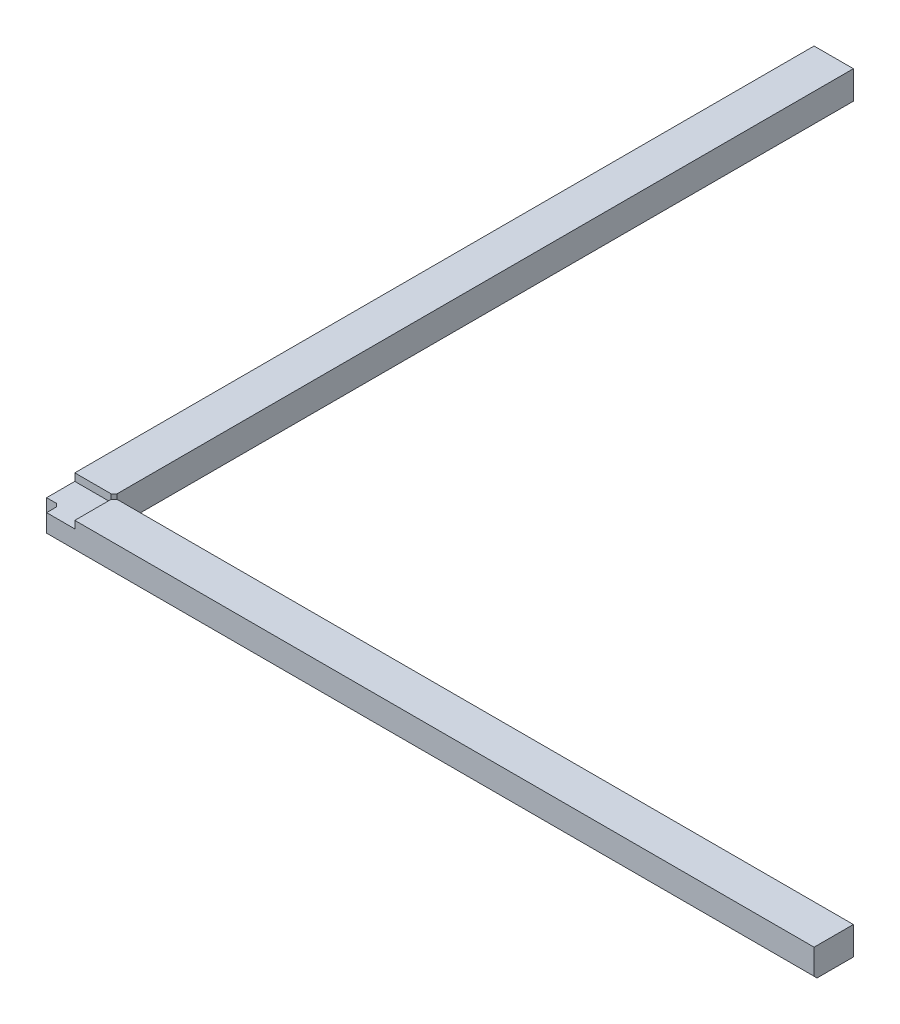
from build123d import *

# Parameters (mm, degrees)
BOSS_EXTRU_1_DEPTH      = 3.8
ENL_V_MAT_EXTRU_1_DEPTH = 1
ENL_V_MAT_EXTRU_2_REACH = 150.872
ESQUISSE3_W             = 1.75
ESQUISSE3_H             = 1.75
CHANFREIN1_SIZE         = 0.4


with BuildPart() as part:
    # Esquisse1 → Boss.-Extru.1 (new body)
    with BuildSketch(Plane(origin=(0, 0, 0), x_dir=(1, 0, 0), z_dir=(0, 1, 0))):
        Polygon((0, 0), (105.25, 0), (105.25, 5.3), (5.3, 5.3), (5.3, 105.25), (0, 105.25), align=None)
    extrude(amount=BOSS_EXTRU_1_DEPTH)

    # Esquisse2 → Enlèv. mat.-Extru.1 (cut)
    with BuildSketch(Plane(origin=(0, 3.8, 0), x_dir=(1, 0, 0), z_dir=(0, 1, 0))):
        Polygon((5.3, 5.55), (0, 5.55), (0, 0), (5.55, 0), (5.55, 5.3), (5.3, 5.3), align=None)
    extrude(amount=-ENL_V_MAT_EXTRU_1_DEPTH, mode=Mode.SUBTRACT)

    # Esquisse3 → Enlèv. mat.-Extru.2 (cut, up to next)
    with BuildSketch(Plane(origin=(0, 2.8, 0), x_dir=(1, 0, 0), z_dir=(0, 1, 0)), mode=Mode.PRIVATE) as enl_v_mat_extru_2_sk1:
        with Locations((0.875, 0.875)):
            Rectangle(ESQUISSE3_W, ESQUISSE3_H)
    enl_v_mat_extru_2_tool1 = extrude(enl_v_mat_extru_2_sk1.sketch, amount=-ENL_V_MAT_EXTRU_2_REACH, mode=Mode.PRIVATE) & part.part
    add(enl_v_mat_extru_2_tool1.solids().sort_by_distance((0.875, 2.8, -0.875))[0], mode=Mode.SUBTRACT)

    # Chanfrein1
    chanfrein1_edges = [part.edges().sort_by_distance(p)[0] for p in [
        (1.75, 1.4, -1.75),
        (5.55, 3.3, -5.3),
        (5.3, 3.3, -5.55),
        (53.5, 0, 0),
        (0, 0, -53.5),
    ]]
    chamfer(chanfrein1_edges, length=CHANFREIN1_SIZE)


solid = part.part
